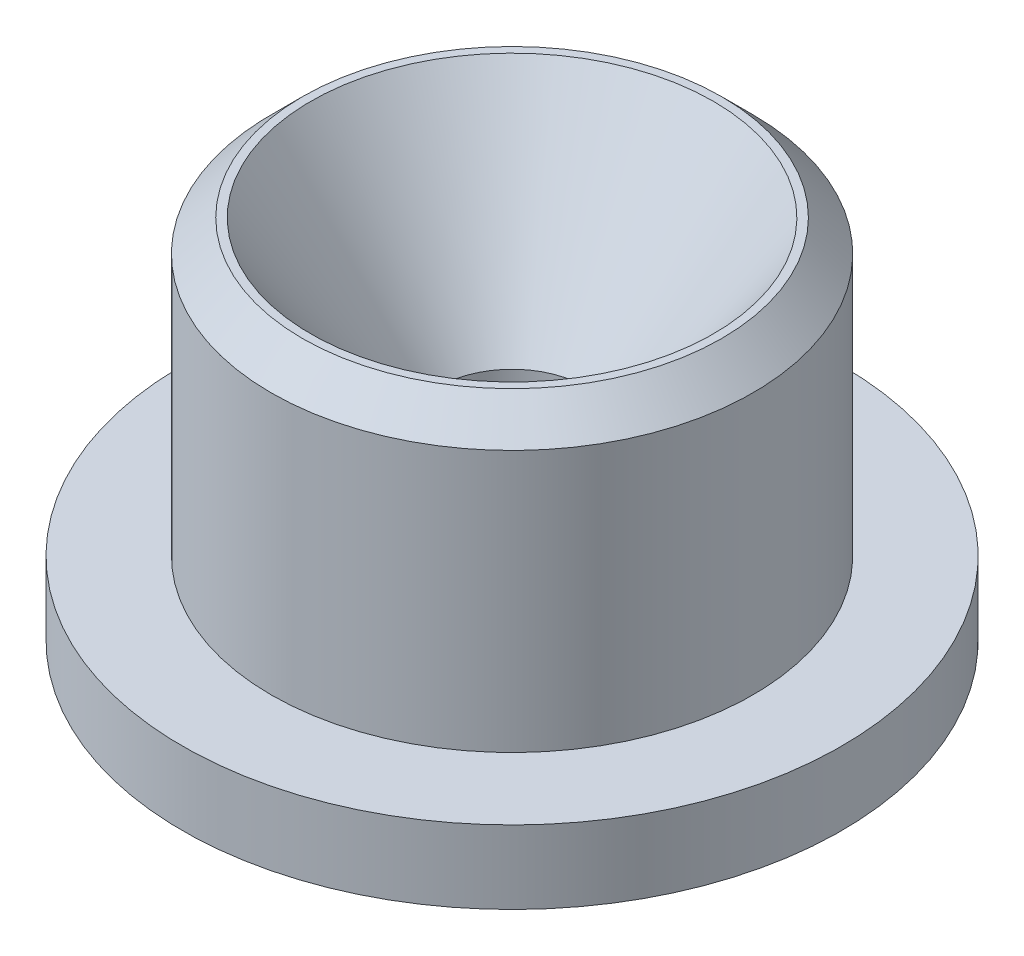
from build123d import *


# Read off the part's stored shape, not the designer's step: G1/4 Straight Pipe Tapped Thread Stud1
with BuildPart() as part:
    # Sketch1 → Revolve1 (revolve)
    with BuildSketch(Plane.XY, mode=Mode.PRIVATE) as revolve1_sk:
        Polygon((7, 0), (2, 0), (2, 3), (5.5, 8), (7, 8), align=None)
        Polygon((7, 0), (2, 0), (2, -2), (9, -2), (9, 0), align=None)
    revolve(revolve1_sk.sketch.rotate(Axis((0, 0, 0), (0, 1, 0)), 90), axis=Axis((0, 0, 0), (0, 1, 0)))

    # G1/4 Straight Pipe Tapped Thread Stud1 o → G1/4 Straight Pipe Tapped Thread Stud1 (revolve, cut)
    with BuildSketch(Plane.XY):
        Polygon((7, 8), (5.7225, 8), (6.5785, 7.144), (6.5785, 0), (7, 0), align=None)
    revolve(axis=Axis((0, 0, 0), (0, 1, 0)), mode=Mode.SUBTRACT)


solid = part.part
